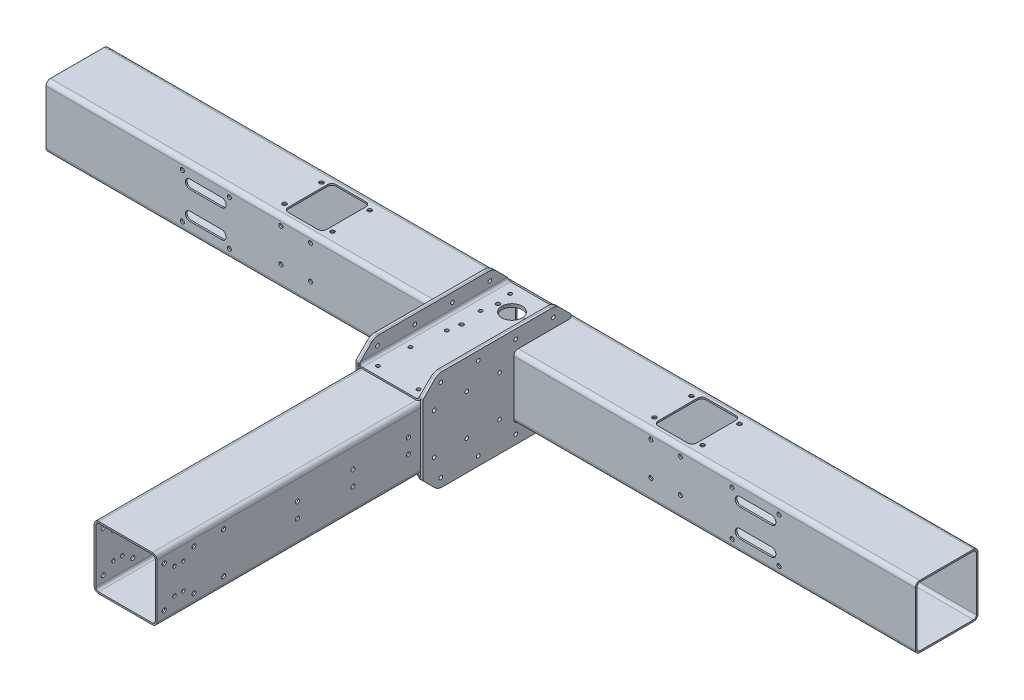
from build123d import *

# Parameters (mm, degrees)
STRUCTURAL_MEMBER1_DEPTH                 = 1175
CUT_EXTRUDE1_DEPTH                       = 595.772326783
CUT_EXTRUDE1_DEPTH_BACK                  = 595.772326783
STRUCTURAL_MEMBER2_DEPTH                 = 480
CUT_EXTRUDE2_DEPTH                       = 2.159
SKETCH18_W                               = 2.75
SKETCH18_H                               = 2.16
M5_CLEARANCE_HOLE_HANDLE_SIDE_AT_2_COUNT = 2
M5_CLEARANCE_HOLE_HANDLE_SIDE_AT_2_PITCH = 40
M5_CLEARANCE_HOLE_HANDLE_SIDE_AT_3_COUNT = 2
M5_CLEARANCE_HOLE_HANDLE_SIDE_AT_3_PITCH = 60.207972894
M5_CLEARANCE_HOLE_HANDLE_SIDE_AT_4_COUNT = 2
M5_CLEARANCE_HOLE_HANDLE_SIDE_AT_4_PITCH = 45
M5_CLEARANCE_HOLE_HANDLE_SIDE_AT_5_COUNT = 2
M5_CLEARANCE_HOLE_HANDLE_SIDE_AT_5_PITCH = 541.871756046
M5_CLEARANCE_HOLE_HANDLE_SIDE_AT_6_COUNT = 2
M5_CLEARANCE_HOLE_HANDLE_SIDE_AT_6_PITCH = 502.020915899
M5_CLEARANCE_HOLE_HANDLE_SIDE_AT_7_COUNT = 2
M5_CLEARANCE_HOLE_HANDLE_SIDE_AT_7_PITCH = 500
M5_CLEARANCE_HOLE_HANDLE_SIDE_AT_8_COUNT = 2
M5_CLEARANCE_HOLE_HANDLE_SIDE_AT_8_PITCH = 540
SKETCH161_W                              = 2.75
SKETCH161_H                              = 2.16
M5_CLEARANCE_HOLE_HANDLE_TOP_AT_2_COUNT  = 2
M5_CLEARANCE_HOLE_HANDLE_TOP_AT_2_PITCH  = 65
M5_CLEARANCE_HOLE_HANDLE_TOP_AT_3_COUNT  = 2
M5_CLEARANCE_HOLE_HANDLE_TOP_AT_3_PITCH  = 82.006097334
M5_CLEARANCE_HOLE_HANDLE_TOP_AT_4_COUNT  = 2
M5_CLEARANCE_HOLE_HANDLE_TOP_AT_4_PITCH  = 50
M5_CLEARANCE_HOLE_HANDLE_TOP_AT_5_COUNT  = 2
M5_CLEARANCE_HOLE_HANDLE_TOP_AT_5_PITCH  = 567.208074696
M5_CLEARANCE_HOLE_HANDLE_TOP_AT_6_COUNT  = 2
M5_CLEARANCE_HOLE_HANDLE_TOP_AT_6_PITCH  = 502.493781056
M5_CLEARANCE_HOLE_HANDLE_TOP_AT_7_COUNT  = 2
M5_CLEARANCE_HOLE_HANDLE_TOP_AT_7_PITCH  = 500
M5_CLEARANCE_HOLE_HANDLE_TOP_AT_8_COUNT  = 2
M5_CLEARANCE_HOLE_HANDLE_TOP_AT_8_PITCH  = 565
CUT_EXTRUDE4_DEPTH                       = 2.159
SKETCH120_W                              = 2.75
SKETCH120_H                              = 2.16
M5_CLEARANCE_HOLE1_AT_2_COUNT            = 2
M5_CLEARANCE_HOLE1_AT_2_PITCH            = 63.5
M5_CLEARANCE_HOLE1_AT_3_COUNT            = 2
M5_CLEARANCE_HOLE1_AT_3_PITCH            = 87.586275323
M5_CLEARANCE_HOLE1_AT_4_COUNT            = 2
M5_CLEARANCE_HOLE1_AT_4_PITCH            = 60.325
M5_CLEARANCE_HOLE1_AT_5_COUNT            = 2
M5_CLEARANCE_HOLE1_AT_5_PITCH            = 808.752963287
M5_CLEARANCE_HOLE1_AT_6_COUNT            = 2
M5_CLEARANCE_HOLE1_AT_6_PITCH            = 745.444904487
M5_CLEARANCE_HOLE1_AT_7_COUNT            = 2
M5_CLEARANCE_HOLE1_AT_7_PITCH            = 743
M5_CLEARANCE_HOLE1_AT_8_COUNT            = 2
M5_CLEARANCE_HOLE1_AT_8_PITCH            = 806.5
CUT_EXTRUDE5_DEPTH                       = 2.159
SKETCH125_W                              = 2.75
SKETCH125_H                              = 2.16
CLEARANCE_HOLE10_AT_2_COUNT              = 2
CLEARANCE_HOLE10_AT_2_PITCH              = 58
CLEARANCE_HOLE10_AT_3_COUNT              = 2
CLEARANCE_HOLE10_AT_3_PITCH              = 107.912001186
CLEARANCE_HOLE10_AT_4_COUNT              = 2
CLEARANCE_HOLE10_AT_4_PITCH              = 91
SKETCH135_W                              = 2.25
SKETCH135_H                              = 629.8291
M4_CLEARANCE_HOLE_CATCH_MOUNT_AT_2_COUNT = 2
M4_CLEARANCE_HOLE_CATCH_MOUNT_AT_2_PITCH = 35
M4_CLEARANCE_HOLE_CATCH_MOUNT_AT_3_COUNT = 2
M4_CLEARANCE_HOLE_CATCH_MOUNT_AT_3_PITCH = 37
M4_CLEARANCE_HOLE_CATCH_MOUNT_AT_4_COUNT = 2
M4_CLEARANCE_HOLE_CATCH_MOUNT_AT_4_PITCH = 12
SKETCH137_W                              = 2.75
SKETCH137_H                              = 629.8291
M5_CLEARANCE_HOLE_SLIDES_AT_2_COUNT      = 2
M5_CLEARANCE_HOLE_SLIDES_AT_2_PITCH      = 40
M5_CLEARANCE_HOLE_SLIDES_AT_3_COUNT      = 2
M5_CLEARANCE_HOLE_SLIDES_AT_3_PITCH      = 80
M5_CLEARANCE_HOLE_SLIDES_AT_4_COUNT      = 2
M5_CLEARANCE_HOLE_SLIDES_AT_4_PITCH      = 97.082439195
M5_CLEARANCE_HOLE_SLIDES_AT_5_COUNT      = 2
M5_CLEARANCE_HOLE_SLIDES_AT_5_PITCH      = 68.007352544
M5_CLEARANCE_HOLE_SLIDES_AT_6_COUNT      = 2
M5_CLEARANCE_HOLE_SLIDES_AT_6_PITCH      = 55
BOSS_EXTRUDE6_START                      = -8
BOSS_EXTRUDE6_DEPTH                      = 200
BOSS_EXTRUDE6_2_DEPTH                    = 200
CHAMFER1_SIZE                            = 20
CHAMFER2_SIZE                            = 20
BOSS_CENTER_PLATE_DEPTH                  = 3.175
SKETCH142_W                              = 2.4257
SKETCH142_H                              = 633.0041
F_11_0_191_DIAMETER_HOLE1_AT_2_COUNT     = 2
F_11_0_191_DIAMETER_HOLE1_AT_2_PITCH     = 111.4582
SKETCH144_W                              = 2.4257
SKETCH144_H                              = 633.0041
F_11_0_191_DIAMETER_HOLE2_AT_2_COUNT     = 2
F_11_0_191_DIAMETER_HOLE2_AT_2_PITCH     = 55
CRVPATTERN3_START                        = 41
CRVPATTERN3_OUTLINE_R                    = 2.4257
CRVPATTERN3_DEPTH                        = 6
CRVPATTERN3_START_2                      = -43
CRVPATTERN3_2_OUTLINE_R                  = 2.4257
CRVPATTERN3_2_DEPTH                      = 86
CRVPATTERN3_3_OUTLINE_R                  = 2.4257
CRVPATTERN3_3_DEPTH                      = 86
CRVPATTERN4_START                        = 42.3291
CRVPATTERN4_OUTLINE_R                    = 2.4257
CRVPATTERN4_DEPTH                        = 3.175
CRVPATTERN4_START_2                      = -43
CRVPATTERN4_2_OUTLINE_R                  = 2.4257
CRVPATTERN4_2_DEPTH                      = 86
SKETCH146_W                              = 2.4257
SKETCH146_H                              = 112.2172
F_11_0_191_DIAMETER_HOLE3_AT_2_COUNT     = 2
F_11_0_191_DIAMETER_HOLE3_AT_2_PITCH     = 55
CRVPATTERN10_START                       = -45
CRVPATTERN10_OUTLINE_R                   = 2.4257
CRVPATTERN10_DEPTH                       = 4
CRVPATTERN10_START_2                     = 41
CRVPATTERN10_2_OUTLINE_R                 = 2.4257
CRVPATTERN10_2_DEPTH                     = 4
CRVPATTERN10_START_3                     = -43
CRVPATTERN10_3_OUTLINE_R                 = 2.4257
CRVPATTERN10_3_DEPTH                     = 86
CUT_EXTRUDE10_DEPTH                      = 824.473806694
CUT_EXTRUDE9_START                       = -4.318
SKETCH148_R                              = 13.75
CUT_EXTRUDE9_DEPTH                       = 4.318
CLEARANCE_START                          = 41
CLEARANCE_HOLE11_OUTLINE_R               = 2.75
CLEARANCE_HOLE11_DEPTH                   = 4
CLEARANCE_START_2                        = 39
CLEARANCE_HOLE11_2_OUTLINE_R             = 2.75
CLEARANCE_HOLE11_2_DEPTH                 = 4
CUT_EXTRUDE11_DEPTH                      = 2.159
F_0_191_START                            = 41
F_0_191_DIAMETER_HOLE5_OUTLINE_R         = 2.4257
F_0_191_DIAMETER_HOLE5_DEPTH             = 4
F_0_191_START_2                          = 39
F_0_191_DIAMETER_HOLE5_2_OUTLINE_R       = 2.4257
F_0_191_DIAMETER_HOLE5_2_DEPTH           = 4
F_0_191_DIAMETER_HOLE5_3_OUTLINE_R       = 2.4257
F_0_191_DIAMETER_HOLE5_3_DEPTH           = 4
F_11_START                               = -44.4881
F_11_0_191_DIAMETER_HOLE5_OUTLINE_R      = 2.4257
F_11_0_191_DIAMETER_HOLE5_DEPTH          = 2.159
F_11_START_2                             = -43
F_11_0_191_DIAMETER_HOLE5_2_OUTLINE_R    = 2.4257
F_11_0_191_DIAMETER_HOLE5_2_DEPTH        = 4
F_11_0_191_DIAMETER_HOLE5_3_OUTLINE_R    = 2.4257
F_11_0_191_DIAMETER_HOLE5_3_DEPTH        = 4
M5_START                                 = 41
M5_CLEARANCE_HOLE4_OUTLINE_R             = 2.75
M5_CLEARANCE_HOLE4_DEPTH                 = 4
M5_START_2                               = 39
M5_CLEARANCE_HOLE4_2_OUTLINE_R           = 2.75
M5_CLEARANCE_HOLE4_2_DEPTH               = 4
M5_START_3                               = -45
M5_CLEARANCE_HOLE6_OUTLINE_R             = 2.75
M5_CLEARANCE_HOLE6_DEPTH                 = 4
M5_START_4                               = -43
M5_CLEARANCE_HOLE6_2_OUTLINE_R           = 2.75
M5_CLEARANCE_HOLE6_2_DEPTH               = 4
SKETCH163_W                              = 2.75
SKETCH163_H                              = 629.8291
M5_CLEARANCE_HOLE9_AT_2_COUNT            = 2
M5_CLEARANCE_HOLE9_AT_2_PITCH            = 75
M5_CLEARANCE_HOLE9_AT_3_COUNT            = 2
M5_CLEARANCE_HOLE9_AT_3_PITCH            = 150
M5_CLEARANCE_HOLE9_AT_4_COUNT            = 2
M5_CLEARANCE_HOLE9_AT_4_PITCH            = 151.340708337
M5_CLEARANCE_HOLE9_AT_5_COUNT            = 2
M5_CLEARANCE_HOLE9_AT_5_PITCH            = 77.646699865
M5_CLEARANCE_HOLE9_AT_6_COUNT            = 2
M5_CLEARANCE_HOLE9_AT_6_PITCH            = 20.1
FILLET2_R                                = 15
FILLET3_R                                = 2
FILLET4_R                                = 15
FILLET5_R                                = 2
FILLET6_R                                = 15
FILLET7_R                                = 2


with BuildPart() as part:
    # Sketch167 → Structural Member1 (new body)
    with BuildSketch(Plane(origin=(-587.5, 0, 0), x_dir=(0, 0, -1), z_dir=(1, 0, 0))):
        with BuildLine():
            Line((-42.3291, 36.3855), (-42.3291, -36.3855))
            ThreePointArc((-42.3291, -36.3855), (-40.588259865, -40.588259865), (-36.3855, -42.3291))
            Line((-36.3855, -42.3291), (36.3855, -42.3291))
            ThreePointArc((36.3855, -42.3291), (40.588259865, -40.588259865), (42.3291, -36.3855))
            Line((42.3291, -36.3855), (42.3291, 36.3855))
            ThreePointArc((42.3291, 36.3855), (40.588259865, 40.588259865), (36.3855, 42.3291))
            Line((36.3855, 42.3291), (-36.3855, 42.3291))
            ThreePointArc((-36.3855, 42.3291), (-40.588259865, 40.588259865), (-42.3291, 36.3855))
        make_face()
        with BuildLine():
            Line((-40.1701, 36.3855), (-40.1701, -36.3855))
            ThreePointArc((-40.1701, -36.3855), (-39.061616324, -39.061616324), (-36.3855, -40.1701))
            Line((-36.3855, -40.1701), (36.3855, -40.1701))
            ThreePointArc((36.3855, -40.1701), (39.061616324, -39.061616324), (40.1701, -36.3855))
            Line((40.1701, -36.3855), (40.1701, 36.3855))
            ThreePointArc((40.1701, 36.3855), (39.061616324, 39.061616324), (36.3855, 40.1701))
            Line((36.3855, 40.1701), (-36.3855, 40.1701))
            ThreePointArc((-36.3855, 40.1701), (-39.061616324, 39.061616324), (-40.1701, 36.3855))
        make_face(mode=Mode.SUBTRACT)
    extrude(amount=STRUCTURAL_MEMBER1_DEPTH)

    # Sketch12 → Cut-Extrude1 (cut, two sides: drawn at the far end of the back side and taken through both)
    with BuildSketch(Plane(origin=(0, 0, 40.1701), x_dir=(-1, 0, 0), z_dir=(0, 0, -1)).offset(-CUT_EXTRUDE1_DEPTH_BACK)):
        with BuildLine():
            Line((29.15, -35.5), (-29.15, -35.5))
            ThreePointArc((-29.15, -35.5), (-33.640128061, -33.640128061), (-35.5, -29.15))
            Line((-35.5, -29.15), (-35.5, 29.15))
            ThreePointArc((-35.5, 29.15), (-33.640128061, 33.640128061), (-29.15, 35.5))
            Line((-29.15, 35.5), (29.15, 35.5))
            ThreePointArc((29.15, 35.5), (33.640128061, 33.640128061), (35.5, 29.15))
            Line((35.5, 29.15), (35.5, -29.15))
            ThreePointArc((35.5, -29.15), (33.640128061, -33.640128061), (29.15, -35.5))
        make_face()
    extrude(amount=CUT_EXTRUDE1_DEPTH + CUT_EXTRUDE1_DEPTH_BACK, mode=Mode.SUBTRACT)

    # Sketch17 → Cut-Extrude2 (cut)
    with BuildSketch(Plane(origin=(0, 42.3291, 0), x_dir=(1, 0, 0), z_dir=(0, 1, 0))):
        with BuildLine():
            Line((-270, 32.5), (-230, 32.5))
            ThreePointArc((-230, 32.5), (-225.757359313, 30.742640687), (-224, 26.5))
            Line((-224, 26.5), (-224, -26.5))
            ThreePointArc((-224, -26.5), (-225.757359313, -30.742640687), (-230, -32.5))
            Line((-230, -32.5), (-270, -32.5))
            ThreePointArc((-270, -32.5), (-274.242640687, -30.742640687), (-276, -26.5))
            Line((-276, -26.5), (-276, 26.5))
            ThreePointArc((-276, 26.5), (-274.242640687, 30.742640687), (-270, 32.5))
        make_face()
        with BuildLine():
            Line((276, 26.5), (276, -26.5))
            ThreePointArc((276, -26.5), (274.242640687, -30.742640687), (270, -32.5))
            Line((270, -32.5), (230, -32.5))
            ThreePointArc((230, -32.5), (225.757359313, -30.742640687), (224, -26.5))
            Line((224, -26.5), (224, 26.5))
            ThreePointArc((224, 26.5), (225.757359313, 30.742640687), (230, 32.5))
            Line((230, 32.5), (270, 32.5))
            ThreePointArc((270, 32.5), (274.242640687, 30.742640687), (276, 26.5))
        make_face()
    extrude(amount=-CUT_EXTRUDE2_DEPTH, mode=Mode.SUBTRACT)

    # Sketch18 → M5 Clearance Hole- HANDLE SIDE (revolve, cut)
    with BuildSketch(Plane(origin=(-270, 31.384, 42.3291), x_dir=(0, -1, 0), z_dir=(1, 0, 0))):
        with Locations((1.375, 1.08)):
            Rectangle(SKETCH18_W, SKETCH18_H)
    m5_clearance_hole_handle_side = revolve(axis=Axis((-270, 31.384, 48.6791), (0, 0, -1)), mode=Mode.SUBTRACT)

    # M5 Clearance Hole- HANDLE SIDE at 2: M5 Clearance Hole- HANDLE SIDE ×2
    with Locations(*[(i * M5_CLEARANCE_HOLE_HANDLE_SIDE_AT_2_PITCH, 0, 0) for i in range(1, M5_CLEARANCE_HOLE_HANDLE_SIDE_AT_2_COUNT)]):
        add(m5_clearance_hole_handle_side, mode=Mode.SUBTRACT)

    # M5 Clearance Hole- HANDLE SIDE at 3: M5 Clearance Hole- HANDLE SIDE ×2
    with Locations(*[Vector(0.6643638388299201, -0.7474093186836595, 0) * (i * M5_CLEARANCE_HOLE_HANDLE_SIDE_AT_3_PITCH) for i in range(1, M5_CLEARANCE_HOLE_HANDLE_SIDE_AT_3_COUNT)]):
        add(m5_clearance_hole_handle_side, mode=Mode.SUBTRACT)

    # M5 Clearance Hole- HANDLE SIDE at 4: M5 Clearance Hole- HANDLE SIDE ×2
    with Locations(*[(0, -i * M5_CLEARANCE_HOLE_HANDLE_SIDE_AT_4_PITCH, 0) for i in range(1, M5_CLEARANCE_HOLE_HANDLE_SIDE_AT_4_COUNT)]):
        add(m5_clearance_hole_handle_side, mode=Mode.SUBTRACT)

    # M5 Clearance Hole- HANDLE SIDE at 5: M5 Clearance Hole- HANDLE SIDE ×2
    with Locations(*[Vector(0.9965457582448797, -0.08304547985373982, 0) * (i * M5_CLEARANCE_HOLE_HANDLE_SIDE_AT_5_PITCH) for i in range(1, M5_CLEARANCE_HOLE_HANDLE_SIDE_AT_5_COUNT)]):
        add(m5_clearance_hole_handle_side, mode=Mode.SUBTRACT)

    # M5 Clearance Hole- HANDLE SIDE at 6: M5 Clearance Hole- HANDLE SIDE ×2
    with Locations(*[Vector(0.9959744388432288, -0.08963769949589045, 0) * (i * M5_CLEARANCE_HOLE_HANDLE_SIDE_AT_6_PITCH) for i in range(1, M5_CLEARANCE_HOLE_HANDLE_SIDE_AT_6_COUNT)]):
        add(m5_clearance_hole_handle_side, mode=Mode.SUBTRACT)

    # M5 Clearance Hole- HANDLE SIDE at 7: M5 Clearance Hole- HANDLE SIDE ×2
    with Locations(*[(i * M5_CLEARANCE_HOLE_HANDLE_SIDE_AT_7_PITCH, 0, 0) for i in range(1, M5_CLEARANCE_HOLE_HANDLE_SIDE_AT_7_COUNT)]):
        add(m5_clearance_hole_handle_side, mode=Mode.SUBTRACT)

    # M5 Clearance Hole- HANDLE SIDE at 8: M5 Clearance Hole- HANDLE SIDE ×2
    with Locations(*[(i * M5_CLEARANCE_HOLE_HANDLE_SIDE_AT_8_PITCH, 0, 0) for i in range(1, M5_CLEARANCE_HOLE_HANDLE_SIDE_AT_8_COUNT)]):
        add(m5_clearance_hole_handle_side, mode=Mode.SUBTRACT)

    # Sketch161 → M5 Clearance Hole- HANDLE TOP (revolve, cut)
    with BuildSketch(Plane(origin=(-282.5, 42.3291, -25), x_dir=(0, 0, 1), z_dir=(1, 0, 0))):
        with Locations((1.375, 1.08)):
            Rectangle(SKETCH161_W, SKETCH161_H)
    m5_clearance_hole_handle_top = revolve(axis=Axis((-282.5, 48.6791, -25), (0, -1, 0)), mode=Mode.SUBTRACT)

    # M5 Clearance Hole- HANDLE TOP at 2: M5 Clearance Hole- HANDLE TOP ×2
    with Locations(*[(i * M5_CLEARANCE_HOLE_HANDLE_TOP_AT_2_PITCH, 0, 0) for i in range(1, M5_CLEARANCE_HOLE_HANDLE_TOP_AT_2_COUNT)]):
        add(m5_clearance_hole_handle_top, mode=Mode.SUBTRACT)

    # M5 Clearance Hole- HANDLE TOP at 3: M5 Clearance Hole- HANDLE TOP ×2
    with Locations(*[Vector(0.7926239891046006, 0, 0.6097107608496919) * (i * M5_CLEARANCE_HOLE_HANDLE_TOP_AT_3_PITCH) for i in range(1, M5_CLEARANCE_HOLE_HANDLE_TOP_AT_3_COUNT)]):
        add(m5_clearance_hole_handle_top, mode=Mode.SUBTRACT)

    # M5 Clearance Hole- HANDLE TOP at 4: M5 Clearance Hole- HANDLE TOP ×2
    with Locations(*[(0, 0, i * M5_CLEARANCE_HOLE_HANDLE_TOP_AT_4_PITCH) for i in range(1, M5_CLEARANCE_HOLE_HANDLE_TOP_AT_4_COUNT)]):
        add(m5_clearance_hole_handle_top, mode=Mode.SUBTRACT)

    # M5 Clearance Hole- HANDLE TOP at 5: M5 Clearance Hole- HANDLE TOP ×2
    with Locations(*[Vector(0.9961071169572434, 0, 0.08815107229710119) * (i * M5_CLEARANCE_HOLE_HANDLE_TOP_AT_5_PITCH) for i in range(1, M5_CLEARANCE_HOLE_HANDLE_TOP_AT_5_COUNT)]):
        add(m5_clearance_hole_handle_top, mode=Mode.SUBTRACT)

    # M5 Clearance Hole- HANDLE TOP at 6: M5 Clearance Hole- HANDLE TOP ×2
    with Locations(*[Vector(0.9950371902099892, 0, 0.09950371902099893) * (i * M5_CLEARANCE_HOLE_HANDLE_TOP_AT_6_PITCH) for i in range(1, M5_CLEARANCE_HOLE_HANDLE_TOP_AT_6_COUNT)]):
        add(m5_clearance_hole_handle_top, mode=Mode.SUBTRACT)

    # M5 Clearance Hole- HANDLE TOP at 7: M5 Clearance Hole- HANDLE TOP ×2
    with Locations(*[(i * M5_CLEARANCE_HOLE_HANDLE_TOP_AT_7_PITCH, 0, 0) for i in range(1, M5_CLEARANCE_HOLE_HANDLE_TOP_AT_7_COUNT)]):
        add(m5_clearance_hole_handle_top, mode=Mode.SUBTRACT)

    # M5 Clearance Hole- HANDLE TOP at 8: M5 Clearance Hole- HANDLE TOP ×2
    with Locations(*[(i * M5_CLEARANCE_HOLE_HANDLE_TOP_AT_8_PITCH, 0, 0) for i in range(1, M5_CLEARANCE_HOLE_HANDLE_TOP_AT_8_COUNT)]):
        add(m5_clearance_hole_handle_top, mode=Mode.SUBTRACT)

    # Sketch120 → M5 Clearance Hole1 (revolve, cut)
    with BuildSketch(Plane(origin=(-403.25, 30.1625, 42.3291), x_dir=(0, -1, 0), z_dir=(1, 0, 0))):
        with Locations((1.375, 1.08)):
            Rectangle(SKETCH120_W, SKETCH120_H)
    m5_clearance_hole1 = revolve(axis=Axis((-403.25, 30.1625, 48.6791), (0, 0, -1)), mode=Mode.SUBTRACT)

    # M5 Clearance Hole1 at 2: M5 Clearance Hole1 ×2
    with Locations(*[(i * M5_CLEARANCE_HOLE1_AT_2_PITCH, 0, 0) for i in range(1, M5_CLEARANCE_HOLE1_AT_2_COUNT)]):
        add(m5_clearance_hole1, mode=Mode.SUBTRACT)

    # M5 Clearance Hole1 at 3: M5 Clearance Hole1 ×2
    with Locations(*[Vector(0.7249994335944139, -0.6887494619146931, 0) * (i * M5_CLEARANCE_HOLE1_AT_3_PITCH) for i in range(1, M5_CLEARANCE_HOLE1_AT_3_COUNT)]):
        add(m5_clearance_hole1, mode=Mode.SUBTRACT)

    # M5 Clearance Hole1 at 4: M5 Clearance Hole1 ×2
    with Locations(*[(0, -i * M5_CLEARANCE_HOLE1_AT_4_PITCH, 0) for i in range(1, M5_CLEARANCE_HOLE1_AT_4_COUNT)]):
        add(m5_clearance_hole1, mode=Mode.SUBTRACT)

    # M5 Clearance Hole1 at 5: M5 Clearance Hole1 ×2
    with Locations(*[Vector(0.9972142750766156, -0.07459014400991548, 0) * (i * M5_CLEARANCE_HOLE1_AT_5_PITCH) for i in range(1, M5_CLEARANCE_HOLE1_AT_5_COUNT)]):
        add(m5_clearance_hole1, mode=Mode.SUBTRACT)

    # M5 Clearance Hole1 at 6: M5 Clearance Hole1 ×2
    with Locations(*[Vector(0.9967202076614105, -0.08092482708906404, 0) * (i * M5_CLEARANCE_HOLE1_AT_6_PITCH) for i in range(1, M5_CLEARANCE_HOLE1_AT_6_COUNT)]):
        add(m5_clearance_hole1, mode=Mode.SUBTRACT)

    # M5 Clearance Hole1 at 7: M5 Clearance Hole1 ×2
    with Locations(*[(i * M5_CLEARANCE_HOLE1_AT_7_PITCH, 0, 0) for i in range(1, M5_CLEARANCE_HOLE1_AT_7_COUNT)]):
        add(m5_clearance_hole1, mode=Mode.SUBTRACT)

    # M5 Clearance Hole1 at 8: M5 Clearance Hole1 ×2
    with Locations(*[(i * M5_CLEARANCE_HOLE1_AT_8_PITCH, 0, 0) for i in range(1, M5_CLEARANCE_HOLE1_AT_8_COUNT)]):
        add(m5_clearance_hole1, mode=Mode.SUBTRACT)

    # Sketch122 → Cut-Extrude5 (cut)
    with BuildSketch(Plane.XY.offset(42.3291)):
        with BuildLine():
            Line((-393, 24.75), (-350, 24.75))
            ThreePointArc((-350, 24.75), (-344, 18.75), (-350, 12.75))
            Line((-350, 12.75), (-393, 12.75))
            ThreePointArc((-393, 12.75), (-399, 18.75), (-393, 24.75))
        make_face()
        with BuildLine():
            Line((-393, -24.75), (-350, -24.75))
            ThreePointArc((-350, -24.75), (-344, -18.75), (-350, -12.75))
            Line((-350, -12.75), (-393, -12.75))
            ThreePointArc((-393, -12.75), (-399, -18.75), (-393, -24.75))
        make_face()
        with BuildLine():
            Line((393, 24.75), (350, 24.75))
            ThreePointArc((350, 24.75), (344, 18.75), (350, 12.75))
            Line((350, 12.75), (393, 12.75))
            ThreePointArc((393, 12.75), (399, 18.75), (393, 24.75))
        make_face()
        with BuildLine():
            Line((393, -24.75), (350, -24.75))
            ThreePointArc((350, -24.75), (344, -18.75), (350, -12.75))
            Line((350, -12.75), (393, -12.75))
            ThreePointArc((393, -12.75), (399, -18.75), (393, -24.75))
        make_face()
    extrude(amount=-CUT_EXTRUDE5_DEPTH, mode=Mode.SUBTRACT)

    # Sketch125 → Clearance Hole10 (revolve, cut)
    with BuildSketch(Plane(origin=(45.5, 29, -42.3291), x_dir=(0, 1, 0), z_dir=(1, 0, 0))):
        with Locations((1.375, 1.08)):
            Rectangle(SKETCH125_W, SKETCH125_H)
    clearance_hole10 = revolve(axis=Axis((45.5, 29, -48.6791), (0, 0, 1)), mode=Mode.SUBTRACT)

    # Clearance Hole10 at 2: Clearance Hole10 ×2
    with Locations(*[(0, -i * CLEARANCE_HOLE10_AT_2_PITCH, 0) for i in range(1, CLEARANCE_HOLE10_AT_2_COUNT)]):
        add(clearance_hole10, mode=Mode.SUBTRACT)

    # Clearance Hole10 at 3: Clearance Hole10 ×2
    with Locations(*[Vector(-0.8432797001236413, -0.5374749737051779, 0) * (i * CLEARANCE_HOLE10_AT_3_PITCH) for i in range(1, CLEARANCE_HOLE10_AT_3_COUNT)]):
        add(clearance_hole10, mode=Mode.SUBTRACT)

    # Clearance Hole10 at 4: Clearance Hole10 ×2
    with Locations(*[(-i * CLEARANCE_HOLE10_AT_4_PITCH, 0, 0) for i in range(1, CLEARANCE_HOLE10_AT_4_COUNT)]):
        add(clearance_hole10, mode=Mode.SUBTRACT)


with BuildPart() as body_2:
    # Sketch168 → Structural Member2 (new body)
    with BuildSketch(Plane.XY.offset(42.3291)):
        with BuildLine():
            Line((-42.3291, 36.3855), (-42.3291, -36.3855))
            ThreePointArc((-42.3291, -36.3855), (-40.588259865, -40.588259865), (-36.3855, -42.3291))
            Line((-36.3855, -42.3291), (36.3855, -42.3291))
            ThreePointArc((36.3855, -42.3291), (40.588259865, -40.588259865), (42.3291, -36.3855))
            Line((42.3291, -36.3855), (42.3291, 36.3855))
            ThreePointArc((42.3291, 36.3855), (40.588259865, 40.588259865), (36.3855, 42.3291))
            Line((36.3855, 42.3291), (-36.3855, 42.3291))
            ThreePointArc((-36.3855, 42.3291), (-40.588259865, 40.588259865), (-42.3291, 36.3855))
        make_face()
        with BuildLine():
            Line((-40.1701, 36.3855), (-40.1701, -36.3855))
            ThreePointArc((-40.1701, -36.3855), (-39.061616324, -39.061616324), (-36.3855, -40.1701))
            Line((-36.3855, -40.1701), (36.3855, -40.1701))
            ThreePointArc((36.3855, -40.1701), (39.061616324, -39.061616324), (40.1701, -36.3855))
            Line((40.1701, -36.3855), (40.1701, 36.3855))
            ThreePointArc((40.1701, 36.3855), (39.061616324, 39.061616324), (36.3855, 40.1701))
            Line((36.3855, 40.1701), (-36.3855, 40.1701))
            ThreePointArc((-36.3855, 40.1701), (-39.061616324, 39.061616324), (-40.1701, 36.3855))
        make_face(mode=Mode.SUBTRACT)
    extrude(amount=STRUCTURAL_MEMBER2_DEPTH)

    # Sketch119 → Cut-Extrude4 (cut)
    with BuildSketch(Plane.XZ.offset(42.3291)):
        with BuildLine():
            Line((-15, 332.3291), (15, 332.3291))
            ThreePointArc((15, 332.3291), (22.071067812, 329.400167812), (25, 322.3291))
            Line((25, 322.3291), (25, 192.3291))
            ThreePointArc((25, 192.3291), (22.071067812, 185.258032188), (15, 182.3291))
            Line((15, 182.3291), (-15, 182.3291))
            ThreePointArc((-15, 182.3291), (-22.071067812, 185.258032188), (-25, 192.3291))
            Line((-25, 192.3291), (-25, 322.3291))
            ThreePointArc((-25, 322.3291), (-22.071067812, 329.400167812), (-15, 332.3291))
        make_face()
    extrude(amount=-CUT_EXTRUDE4_DEPTH, mode=Mode.SUBTRACT)

    # Sketch135 → M4 Clearance Hole - CATCH MOUNT (revolve, cut)
    with BuildSketch(Plane(origin=(-42.3291, 17.5, 498.6291), x_dir=(0, 0, 1), z_dir=(0, 1, 0))):
        with Locations((1.125, 314.91455)):
            Rectangle(SKETCH135_W, SKETCH135_H)
    m4_clearance_hole_catch_mount = revolve(axis=Axis((-48.6791, 17.5, 498.6291), (1, 0, 0)), mode=Mode.SUBTRACT)

    # M4 Clearance Hole - CATCH MOUNT at 2: M4 Clearance Hole - CATCH MOUNT ×2
    with Locations(*[(0, -i * M4_CLEARANCE_HOLE_CATCH_MOUNT_AT_2_PITCH, 0) for i in range(1, M4_CLEARANCE_HOLE_CATCH_MOUNT_AT_2_COUNT)]):
        add(m4_clearance_hole_catch_mount, mode=Mode.SUBTRACT)

    # M4 Clearance Hole - CATCH MOUNT at 3: M4 Clearance Hole - CATCH MOUNT ×2
    with Locations(*[Vector(0, -0.9459459459459459, -0.3243243243243243) * (i * M4_CLEARANCE_HOLE_CATCH_MOUNT_AT_3_PITCH) for i in range(1, M4_CLEARANCE_HOLE_CATCH_MOUNT_AT_3_COUNT)]):
        add(m4_clearance_hole_catch_mount, mode=Mode.SUBTRACT)

    # M4 Clearance Hole - CATCH MOUNT at 4: M4 Clearance Hole - CATCH MOUNT ×2
    with Locations(*[(0, 0, -i * M4_CLEARANCE_HOLE_CATCH_MOUNT_AT_4_PITCH) for i in range(1, M4_CLEARANCE_HOLE_CATCH_MOUNT_AT_4_COUNT)]):
        add(m4_clearance_hole_catch_mount, mode=Mode.SUBTRACT)

    # Sketch137 → M5 Clearance Hole - SLIDES (revolve, cut)
    with BuildSketch(Plane(origin=(-42.3291, 27.5, 512.3291), x_dir=(0, 0, 1), z_dir=(0, 1, 0))):
        with Locations((1.375, 314.91455)):
            Rectangle(SKETCH137_W, SKETCH137_H)
    m5_clearance_hole_slides = revolve(axis=Axis((-48.6791, 27.5, 512.3291), (1, 0, 0)), mode=Mode.SUBTRACT)

    # M5 Clearance Hole - SLIDES at 2: M5 Clearance Hole - SLIDES ×2
    with Locations(*[(0, 0, -i * M5_CLEARANCE_HOLE_SLIDES_AT_2_PITCH) for i in range(1, M5_CLEARANCE_HOLE_SLIDES_AT_2_COUNT)]):
        add(m5_clearance_hole_slides, mode=Mode.SUBTRACT)

    # M5 Clearance Hole - SLIDES at 3: M5 Clearance Hole - SLIDES ×2
    with Locations(*[(0, 0, -i * M5_CLEARANCE_HOLE_SLIDES_AT_3_PITCH) for i in range(1, M5_CLEARANCE_HOLE_SLIDES_AT_3_COUNT)]):
        add(m5_clearance_hole_slides, mode=Mode.SUBTRACT)

    # M5 Clearance Hole - SLIDES at 4: M5 Clearance Hole - SLIDES ×2
    with Locations(*[Vector(0, -0.5665288228870654, -0.8240419241993675) * (i * M5_CLEARANCE_HOLE_SLIDES_AT_4_PITCH) for i in range(1, M5_CLEARANCE_HOLE_SLIDES_AT_4_COUNT)]):
        add(m5_clearance_hole_slides, mode=Mode.SUBTRACT)

    # M5 Clearance Hole - SLIDES at 5: M5 Clearance Hole - SLIDES ×2
    with Locations(*[Vector(0, -0.8087360843031882, -0.5881716976750467) * (i * M5_CLEARANCE_HOLE_SLIDES_AT_5_PITCH) for i in range(1, M5_CLEARANCE_HOLE_SLIDES_AT_5_COUNT)]):
        add(m5_clearance_hole_slides, mode=Mode.SUBTRACT)

    # M5 Clearance Hole - SLIDES at 6: M5 Clearance Hole - SLIDES ×2
    with Locations(*[(0, -i * M5_CLEARANCE_HOLE_SLIDES_AT_6_PITCH, 0) for i in range(1, M5_CLEARANCE_HOLE_SLIDES_AT_6_COUNT)]):
        add(m5_clearance_hole_slides, mode=Mode.SUBTRACT)


with BuildPart() as body_3:
    # Sketch140 → Boss-Extrude6 (new body)
    with BuildSketch(Plane(origin=(0, 0, -42.3291), x_dir=(-1, 0, 0), z_dir=(0, 0, -1)).offset(BOSS_EXTRUDE6_START)):
        with BuildLine():
            Line((-42.3291, 67.7291), (-42.3291, 48.2727))
            ThreePointArc((-42.3291, 48.2727), (-40.588259865, 44.069940135), (-36.3855, 42.3291))
            Line((-36.3855, 42.3291), (36.3855, 42.3291))
            ThreePointArc((36.3855, 42.3291), (40.588259865, 44.069940135), (42.3291, 48.2727))
            Line((42.3291, 48.2727), (42.3291, 67.7291))
            Line((42.3291, 67.7291), (40.1701, 67.7291))
            Line((40.1701, 67.7291), (40.1701, 48.2727))
            ThreePointArc((40.1701, 48.2727), (39.061616324, 45.596583676), (36.3855, 44.4881))
            Line((36.3855, 44.4881), (-36.3855, 44.4881))
            ThreePointArc((-36.3855, 44.4881), (-39.061616324, 45.596583676), (-40.1701, 48.2727))
            Line((-40.1701, 48.2727), (-40.1701, 67.7291))
            Line((-40.1701, 67.7291), (-42.3291, 67.7291))
        make_face()
    extrude(amount=-BOSS_EXTRUDE6_DEPTH)

    # Chamfer1
    chamfer1_edges = [body_3.edges().sort_by_distance(p)[0] for p in [
        (-41.2496, 67.7291, -34.3291),
        (41.2496, 67.7291, -34.3291),
        (-41.2496, 67.7291, 165.6709),
        (41.2496, 67.7291, 165.6709),
    ]]
    chamfer(chamfer1_edges, length=CHAMFER1_SIZE)


with BuildPart() as body_4:
    # Sketch140 → Boss-Extrude6 2 (new body)
    with BuildSketch(Plane(origin=(0, 0, -42.3291), x_dir=(-1, 0, 0), z_dir=(0, 0, -1)).offset(BOSS_EXTRUDE6_START)):
        with BuildLine():
            Line((-40.1701, -67.7291), (-40.1701, -48.2727))
            ThreePointArc((-40.1701, -48.2727), (-39.061616324, -45.596583676), (-36.3855, -44.4881))
            Line((-36.3855, -44.4881), (36.3855, -44.4881))
            ThreePointArc((36.3855, -44.4881), (39.061616324, -45.596583676), (40.1701, -48.2727))
            Line((40.1701, -48.2727), (40.1701, -67.7291))
            Line((40.1701, -67.7291), (42.3291, -67.7291))
            Line((42.3291, -67.7291), (42.3291, -48.2727))
            ThreePointArc((42.3291, -48.2727), (40.588259865, -44.069940135), (36.3855, -42.3291))
            Line((36.3855, -42.3291), (-36.3855, -42.3291))
            ThreePointArc((-36.3855, -42.3291), (-40.588259865, -44.069940135), (-42.3291, -48.2727))
            Line((-42.3291, -48.2727), (-42.3291, -67.7291))
            Line((-42.3291, -67.7291), (-40.1701, -67.7291))
        make_face()
    extrude(amount=-BOSS_EXTRUDE6_2_DEPTH)

    # Chamfer2
    chamfer2_edges = [body_4.edges().sort_by_distance(p)[0] for p in [
        (-41.2496, -67.7291, -34.3291),
        (41.2496, -67.7291, -34.3291),
        (41.2496, -67.7291, 165.6709),
        (-41.2496, -67.7291, 165.6709),
    ]]
    chamfer(chamfer2_edges, length=CHAMFER2_SIZE)


with BuildPart() as body_5:
    # Sketch141 → Boss-Center Plate (new body)
    with BuildSketch(Plane(origin=(42.3291, 0, 0), x_dir=(0, 0, -1), z_dir=(1, 0, 0))):
        with BuildLine():
            Line((-145.6709, 67.7291), (-165.6709, 47.7291))
            Line((-165.6709, 47.7291), (-165.6709, -47.7291))
            Line((-165.6709, -47.7291), (-145.6709, -67.7291))
            Line((-145.6709, -67.7291), (14.3291, -67.7291))
            Line((14.3291, -67.7291), (34.3291, -47.7291))
            Line((34.3291, -47.7291), (34.3291, -42.3291))
            Line((34.3291, -42.3291), (-37.3291, -42.3291))
            ThreePointArc((-37.3291, -42.3291), (-40.864633906, -40.864633906), (-42.3291, -37.3291))
            Line((-42.3291, -37.3291), (-42.3291, 37.3291))
            ThreePointArc((-42.3291, 37.3291), (-40.864633906, 40.864633906), (-37.3291, 42.3291))
            Line((-37.3291, 42.3291), (34.3291, 42.3291))
            Line((34.3291, 42.3291), (34.3291, 47.7291))
            Line((34.3291, 47.7291), (14.3291, 67.7291))
            Line((14.3291, 67.7291), (-145.6709, 67.7291))
        make_face()
    extrude(amount=BOSS_CENTER_PLATE_DEPTH)


with BuildPart() as f_11_0_191_diameter_hole1_tool:
    # Sketch142 → #11 (0.191) Diameter Hole1 (revolve)
    with BuildSketch(Plane(origin=(45.5041, 55.7291, 141.6709), x_dir=(0, 0, -1), z_dir=(0, 1, 0))):
        with Locations((1.21285, 316.50205)):
            Rectangle(SKETCH142_W, SKETCH142_H)
    f_11_0_191_diameter_hole1 = revolve(axis=Axis((51.8541, 55.7291, 141.6709), (-1, 0, 0)))


with BuildPart() as body_3_1:
    add(body_3.part)

    # #11 (0.191) Diameter Hole1: cut by f_11_0_191_diameter_hole1_tool
    add(f_11_0_191_diameter_hole1_tool.part, mode=Mode.SUBTRACT)

    # CrvPattern3 3 outline → CrvPattern3 3 (cut)
    with BuildSketch(Plane.YZ.offset(CRVPATTERN3_START_2)):
        with Locations((55.7291, 91.004233333)):
            Circle(CRVPATTERN3_3_OUTLINE_R)
        with Locations((55.7291, 40.337566667)):
            Circle(CRVPATTERN3_3_OUTLINE_R)
        with Locations((55.7291, -10.3291)):
            Circle(CRVPATTERN3_3_OUTLINE_R)
    extrude(amount=CRVPATTERN3_3_DEPTH, mode=Mode.SUBTRACT)


with BuildPart() as body_5_1:
    add(body_5.part)

    # #11 (0.191) Diameter Hole1: cut by f_11_0_191_diameter_hole1_tool
    add(f_11_0_191_diameter_hole1_tool.part, mode=Mode.SUBTRACT)


with BuildPart() as f_11_0_191_diameter_hole1_at_2_tool:
    # #11 (0.191) Diameter Hole1 at 2: #11 (0.191) Diameter Hole1 ×2
    with Locations(*[(0, -i * F_11_0_191_DIAMETER_HOLE1_AT_2_PITCH, 0) for i in range(1, F_11_0_191_DIAMETER_HOLE1_AT_2_COUNT)]):
        add(f_11_0_191_diameter_hole1)


with BuildPart() as body_4_1:
    add(body_4.part)

    # #11 (0.191) Diameter Hole1 at 2: cut by f_11_0_191_diameter_hole1_at_2_tool
    add(f_11_0_191_diameter_hole1_at_2_tool.part, mode=Mode.SUBTRACT)

    # CrvPattern3 2 outline → CrvPattern3 2 (cut)
    with BuildSketch(Plane.YZ.offset(CRVPATTERN3_START_2)):
        with Locations((-55.7291, 91.004233333)):
            Circle(CRVPATTERN3_2_OUTLINE_R)
        with Locations((-55.7291, 40.337566667)):
            Circle(CRVPATTERN3_2_OUTLINE_R)
        with Locations((-55.7291, -10.3291)):
            Circle(CRVPATTERN3_2_OUTLINE_R)
    extrude(amount=CRVPATTERN3_2_DEPTH, mode=Mode.SUBTRACT)


with BuildPart() as body_5_2:
    add(body_5_1.part)

    # #11 (0.191) Diameter Hole1 at 2: cut by f_11_0_191_diameter_hole1_at_2_tool
    add(f_11_0_191_diameter_hole1_at_2_tool.part, mode=Mode.SUBTRACT)


with BuildPart() as f_11_0_191_diameter_hole2_tool:
    # Sketch144 → #11 (0.191) Diameter Hole2 (revolve)
    with BuildSketch(Plane(origin=(45.5041, 27.5, 150.6709), x_dir=(0, 0, -1), z_dir=(0, 1, 0))):
        with Locations((1.21285, 316.50205)):
            Rectangle(SKETCH144_W, SKETCH144_H)
    f_11_0_191_diameter_hole2 = revolve(axis=Axis((51.8541, 27.5, 150.6709), (-1, 0, 0)))


with BuildPart() as body_2_1:
    add(body_2.part)

    # #11 (0.191) Diameter Hole2: cut by f_11_0_191_diameter_hole2_tool
    add(f_11_0_191_diameter_hole2_tool.part, mode=Mode.SUBTRACT)


with BuildPart() as body_5_3:
    add(body_5_2.part)

    # #11 (0.191) Diameter Hole2: cut by f_11_0_191_diameter_hole2_tool
    add(f_11_0_191_diameter_hole2_tool.part, mode=Mode.SUBTRACT)


with BuildPart() as f_11_0_191_diameter_hole2_at_2_tool:
    # #11 (0.191) Diameter Hole2 at 2: #11 (0.191) Diameter Hole2 ×2
    with Locations(*[(0, -i * F_11_0_191_DIAMETER_HOLE2_AT_2_PITCH, 0) for i in range(1, F_11_0_191_DIAMETER_HOLE2_AT_2_COUNT)]):
        add(f_11_0_191_diameter_hole2)


with BuildPart() as body_2_2:
    add(body_2_1.part)

    # #11 (0.191) Diameter Hole2 at 2: cut by f_11_0_191_diameter_hole2_at_2_tool
    add(f_11_0_191_diameter_hole2_at_2_tool.part, mode=Mode.SUBTRACT)

    # CrvPattern4 2 outline → CrvPattern4 2 (cut)
    with BuildSketch(Plane.YZ.offset(CRVPATTERN4_START_2)):
        with Locations((27.5, 106.5)):
            Circle(CRVPATTERN4_2_OUTLINE_R)
        with Locations((27.5, 62.3291)):
            Circle(CRVPATTERN4_2_OUTLINE_R)
        with Locations((-27.5, 106.5)):
            Circle(CRVPATTERN4_2_OUTLINE_R)
        with Locations((-27.5, 62.3291)):
            Circle(CRVPATTERN4_2_OUTLINE_R)
    extrude(amount=CRVPATTERN4_2_DEPTH, mode=Mode.SUBTRACT)


with BuildPart() as body_5_4:
    add(body_5_3.part)

    # #11 (0.191) Diameter Hole2 at 2: cut by f_11_0_191_diameter_hole2_at_2_tool
    add(f_11_0_191_diameter_hole2_at_2_tool.part, mode=Mode.SUBTRACT)

    # CrvPattern3: read off the stored shape, not the designer's step
    # CrvPattern3 outline → CrvPattern3 (cut)
    with BuildSketch(Plane.YZ.offset(CRVPATTERN3_START)):
        with Locations((55.7291, 91.004233333)):
            Circle(CRVPATTERN3_OUTLINE_R)
        with Locations((55.7291, 40.337566667)):
            Circle(CRVPATTERN3_OUTLINE_R)
        with Locations((55.7291, -10.3291)):
            Circle(CRVPATTERN3_OUTLINE_R)
        with Locations((-55.7291, 91.004233333)):
            Circle(CRVPATTERN3_OUTLINE_R)
        with Locations((-55.7291, 40.337566667)):
            Circle(CRVPATTERN3_OUTLINE_R)
        with Locations((-55.7291, -10.3291)):
            Circle(CRVPATTERN3_OUTLINE_R)
    extrude(amount=CRVPATTERN3_DEPTH, mode=Mode.SUBTRACT)

    # CrvPattern4: read off the stored shape, not the designer's step
    # CrvPattern4 outline → CrvPattern4 (cut)
    with BuildSketch(Plane.YZ.offset(CRVPATTERN4_START)):
        with Locations((27.5, 106.5)):
            Circle(CRVPATTERN4_OUTLINE_R)
        with Locations((27.5, 62.3291)):
            Circle(CRVPATTERN4_OUTLINE_R)
        with Locations((-27.5, 106.5)):
            Circle(CRVPATTERN4_OUTLINE_R)
        with Locations((-27.5, 62.3291)):
            Circle(CRVPATTERN4_OUTLINE_R)
    extrude(amount=CRVPATTERN4_DEPTH, mode=Mode.SUBTRACT)

    # Sketch151 → Cut-Extrude10 (cut, through all)
    with BuildSketch(Plane(origin=(45.5041, 0, 0), x_dir=(0, 0, -1), z_dir=(1, 0, 0))):
        with BuildLine():
            Line((33.8291, 42.8291), (-37.3291, 42.8291))
            ThreePointArc((-37.3291, 42.8291), (-41.218187297, 41.218187297), (-42.8291, 37.3291))
            Line((-42.8291, 37.3291), (-42.8291, -37.3291))
            ThreePointArc((-42.8291, -37.3291), (-41.218187297, -41.218187297), (-37.3291, -42.8291))
            Line((-37.3291, -42.8291), (33.8291, -42.8291))
            Line((33.8291, -42.8291), (34.3291, -42.8291))
            Line((34.3291, -42.8291), (34.3291, -42.3291))
            Line((34.3291, -42.3291), (-37.3291, -42.3291))
            ThreePointArc((-37.3291, -42.3291), (-40.864633906, -40.864633906), (-42.3291, -37.3291))
            Line((-42.3291, -37.3291), (-42.3291, 37.3291))
            ThreePointArc((-42.3291, 37.3291), (-40.864633906, 40.864633906), (-37.3291, 42.3291))
            Line((-37.3291, 42.3291), (34.3291, 42.3291))
            Line((34.3291, 42.3291), (34.3291, 42.8291))
            Line((34.3291, 42.8291), (33.8291, 42.8291))
        make_face()
    extrude(amount=-CUT_EXTRUDE10_DEPTH, mode=Mode.SUBTRACT)

    # Fillet2
    fillet2_edges = [body_5_4.edges().sort_by_distance(p)[0] for p in [
        (43.9166, 67.7291, -14.3291),
        (43.9166, -67.7291, -14.3291),
        (43.9166, -67.7291, 145.6709),
        (43.9166, 67.7291, 145.6709),
    ]]
    fillet(fillet2_edges, radius=FILLET2_R)

    # Fillet3
    fillet3_edges = [body_5_4.edges().sort_by_distance(p)[0] for p in [
        (43.9166, 42.8291, -34.3291),
        (43.9166, -42.8291, -34.3291),
        (43.9166, 47.7291, -34.3291),
        (43.9166, -47.7291, -34.3291),
        (43.9166, -47.7291, 165.6709),
        (43.9166, 47.7291, 165.6709),
    ]]
    fillet(fillet3_edges, radius=FILLET3_R)


with BuildPart() as f_11_0_191_diameter_hole3_tool:
    # Sketch146 → #11 (0.191) Diameter Hole3 (revolve)
    with BuildSketch(Plane(origin=(-27.5, 44.4881, 153.6709), x_dir=(0, 0, 1), z_dir=(1, 0, 0))):
        with Locations((1.21285, 56.1086)):
            Rectangle(SKETCH146_W, SKETCH146_H)
    f_11_0_191_diameter_hole3 = revolve(axis=Axis((-27.5, 50.8381, 153.6709), (0, -1, 0)))


with BuildPart() as body_2_3:
    add(body_2_2.part)

    # #11 (0.191) Diameter Hole3: cut by f_11_0_191_diameter_hole3_tool
    add(f_11_0_191_diameter_hole3_tool.part, mode=Mode.SUBTRACT)


with BuildPart() as body_3_2:
    add(body_3_1.part)

    # #11 (0.191) Diameter Hole3: cut by f_11_0_191_diameter_hole3_tool
    add(f_11_0_191_diameter_hole3_tool.part, mode=Mode.SUBTRACT)


with BuildPart() as body_4_2:
    add(body_4_1.part)

    # #11 (0.191) Diameter Hole3: cut by f_11_0_191_diameter_hole3_tool
    add(f_11_0_191_diameter_hole3_tool.part, mode=Mode.SUBTRACT)


with BuildPart() as f_11_0_191_diameter_hole3_at_2_tool:
    # #11 (0.191) Diameter Hole3 at 2: #11 (0.191) Diameter Hole3 ×2
    with Locations(*[(i * F_11_0_191_DIAMETER_HOLE3_AT_2_PITCH, 0, 0) for i in range(1, F_11_0_191_DIAMETER_HOLE3_AT_2_COUNT)]):
        add(f_11_0_191_diameter_hole3)


with BuildPart() as body_2_4:
    add(body_2_3.part)

    # #11 (0.191) Diameter Hole3 at 2: cut by f_11_0_191_diameter_hole3_at_2_tool
    add(f_11_0_191_diameter_hole3_at_2_tool.part, mode=Mode.SUBTRACT)

    # CrvPattern10 3 outline → CrvPattern10 3 (cut)
    with BuildSketch(Plane(origin=(0, 0, 0), x_dir=(1, 0, 0), z_dir=(0, 1, 0)).offset(CRVPATTERN10_START_3)):
        with Locations((-27.5, -109.6709)):
            Circle(CRVPATTERN10_3_OUTLINE_R)
        with Locations((27.5, -109.6709)):
            Circle(CRVPATTERN10_3_OUTLINE_R)
    extrude(amount=CRVPATTERN10_3_DEPTH, mode=Mode.SUBTRACT)

    # 0.191_ Diameter Hole5 2 outline → 0.191_ Diameter Hole5 2 (cut)
    with BuildSketch(Plane(origin=(0, 0, 0), x_dir=(1, 0, 0), z_dir=(0, 1, 0)).offset(F_0_191_START_2)):
        with Locations((22.5, -65.6709)):
            Circle(F_0_191_DIAMETER_HOLE5_2_OUTLINE_R)
        with Locations((-22.5, -65.6709)):
            Circle(F_0_191_DIAMETER_HOLE5_2_OUTLINE_R)
    extrude(amount=F_0_191_DIAMETER_HOLE5_2_DEPTH, mode=Mode.SUBTRACT)

    # 11 _0.191_ Diameter Hole5 2 outline → 11 _0.191_ Diameter Hole5 2 (cut)
    with BuildSketch(Plane(origin=(0, 0, 0), x_dir=(1, 0, 0), z_dir=(0, 1, 0)).offset(F_11_START_2)):
        with Locations((-27.5, -65.6709)):
            Circle(F_11_0_191_DIAMETER_HOLE5_2_OUTLINE_R)
        with Locations((27.5, -65.6709)):
            Circle(F_11_0_191_DIAMETER_HOLE5_2_OUTLINE_R)
    extrude(amount=F_11_0_191_DIAMETER_HOLE5_2_DEPTH, mode=Mode.SUBTRACT)

    # M5 Clearance Hole4 2 outline → M5 Clearance Hole4 2 (cut)
    with BuildSketch(Plane(origin=(0, 0, 0), x_dir=(1, 0, 0), z_dir=(0, 1, 0)).offset(M5_START_2)):
        with Locations((19.5, -48.6709)):
            Circle(M5_CLEARANCE_HOLE4_2_OUTLINE_R)
        with Locations((-19.5, -48.6709)):
            Circle(M5_CLEARANCE_HOLE4_2_OUTLINE_R)
    extrude(amount=M5_CLEARANCE_HOLE4_2_DEPTH, mode=Mode.SUBTRACT)

    # M5 Clearance Hole6 2 outline → M5 Clearance Hole6 2 (cut)
    with BuildSketch(Plane(origin=(0, 0, 0), x_dir=(1, 0, 0), z_dir=(0, 1, 0)).offset(M5_START_4)):
        with Locations((-31, -48.6709)):
            Circle(M5_CLEARANCE_HOLE6_2_OUTLINE_R)
        with Locations((31, -48.6709)):
            Circle(M5_CLEARANCE_HOLE6_2_OUTLINE_R)
    extrude(amount=M5_CLEARANCE_HOLE6_2_DEPTH, mode=Mode.SUBTRACT)

    # Sketch163 → M5 Clearance Hole9 (revolve, cut)
    with BuildSketch(Plane(origin=(-42.3291, 10.05, 332.3291), x_dir=(0, 0, 1), z_dir=(0, 1, 0))):
        with Locations((1.375, 314.91455)):
            Rectangle(SKETCH163_W, SKETCH163_H)
    m5_clearance_hole9 = revolve(axis=Axis((-48.6791, 10.05, 332.3291), (1, 0, 0)), mode=Mode.SUBTRACT)

    # M5 Clearance Hole9 at 2: M5 Clearance Hole9 ×2
    with Locations(*[(0, 0, -i * M5_CLEARANCE_HOLE9_AT_2_PITCH) for i in range(1, M5_CLEARANCE_HOLE9_AT_2_COUNT)]):
        add(m5_clearance_hole9, mode=Mode.SUBTRACT)

    # M5 Clearance Hole9 at 3: M5 Clearance Hole9 ×2
    with Locations(*[(0, 0, -i * M5_CLEARANCE_HOLE9_AT_3_PITCH) for i in range(1, M5_CLEARANCE_HOLE9_AT_3_COUNT)]):
        add(m5_clearance_hole9, mode=Mode.SUBTRACT)

    # M5 Clearance Hole9 at 4: M5 Clearance Hole9 ×2
    with Locations(*[Vector(0, -0.13281291082117755, -0.9911411255311758) * (i * M5_CLEARANCE_HOLE9_AT_4_PITCH) for i in range(1, M5_CLEARANCE_HOLE9_AT_4_COUNT)]):
        add(m5_clearance_hole9, mode=Mode.SUBTRACT)

    # M5 Clearance Hole9 at 5: M5 Clearance Hole9 ×2
    with Locations(*[Vector(0, -0.25886483308141084, -0.9659135562739212) * (i * M5_CLEARANCE_HOLE9_AT_5_PITCH) for i in range(1, M5_CLEARANCE_HOLE9_AT_5_COUNT)]):
        add(m5_clearance_hole9, mode=Mode.SUBTRACT)

    # M5 Clearance Hole9 at 6: M5 Clearance Hole9 ×2
    with Locations(*[(0, -i * M5_CLEARANCE_HOLE9_AT_6_PITCH, 0) for i in range(1, M5_CLEARANCE_HOLE9_AT_6_COUNT)]):
        add(m5_clearance_hole9, mode=Mode.SUBTRACT)


with BuildPart() as body_3_3:
    add(body_3_2.part)

    # #11 (0.191) Diameter Hole3 at 2: cut by f_11_0_191_diameter_hole3_at_2_tool
    add(f_11_0_191_diameter_hole3_at_2_tool.part, mode=Mode.SUBTRACT)

    # CrvPattern10 2 outline → CrvPattern10 2 (cut)
    with BuildSketch(Plane(origin=(0, 0, 0), x_dir=(1, 0, 0), z_dir=(0, 1, 0)).offset(CRVPATTERN10_START_2)):
        with Locations((-27.5, -109.6709)):
            Circle(CRVPATTERN10_2_OUTLINE_R)
        with Locations((27.5, -109.6709)):
            Circle(CRVPATTERN10_2_OUTLINE_R)
    extrude(amount=CRVPATTERN10_2_DEPTH, mode=Mode.SUBTRACT)


with BuildPart() as body_4_3:
    add(body_4_2.part)

    # #11 (0.191) Diameter Hole3 at 2: cut by f_11_0_191_diameter_hole3_at_2_tool
    add(f_11_0_191_diameter_hole3_at_2_tool.part, mode=Mode.SUBTRACT)

    # CrvPattern10: read off the stored shape, not the designer's step
    # CrvPattern10 outline → CrvPattern10 (cut)
    with BuildSketch(Plane(origin=(0, 0, 0), x_dir=(1, 0, 0), z_dir=(0, 1, 0)).offset(CRVPATTERN10_START)):
        with Locations((-27.5, -109.6709)):
            Circle(CRVPATTERN10_OUTLINE_R)
        with Locations((27.5, -109.6709)):
            Circle(CRVPATTERN10_OUTLINE_R)
    extrude(amount=CRVPATTERN10_DEPTH, mode=Mode.SUBTRACT)

    # #11 (0.191) Diameter Hole5: read off the stored shape, not the designer's step
    # #11 (0.191) Diameter Hole5 outline → #11 (0.191) Diameter Hole5 (cut)
    with BuildSketch(Plane(origin=(0, 0, 0), x_dir=(1, 0, 0), z_dir=(0, 1, 0)).offset(F_11_START)):
        with Locations((-27.5, -65.6709)):
            Circle(F_11_0_191_DIAMETER_HOLE5_OUTLINE_R)
        with Locations((27.5, -65.6709)):
            Circle(F_11_0_191_DIAMETER_HOLE5_OUTLINE_R)
        with Locations((27.5, -20)):
            Circle(F_11_0_191_DIAMETER_HOLE5_OUTLINE_R)
        with Locations((-27.5, -20)):
            Circle(F_11_0_191_DIAMETER_HOLE5_OUTLINE_R)
        with Locations((-27.5, 20)):
            Circle(F_11_0_191_DIAMETER_HOLE5_OUTLINE_R)
        with Locations((27.5, 20)):
            Circle(F_11_0_191_DIAMETER_HOLE5_OUTLINE_R)
    extrude(amount=F_11_0_191_DIAMETER_HOLE5_DEPTH, mode=Mode.SUBTRACT)

    # M5 Clearance Hole6: read off the stored shape, not the designer's step
    # M5 Clearance Hole6 outline → M5 Clearance Hole6 (cut)
    with BuildSketch(Plane(origin=(0, 0, 0), x_dir=(1, 0, 0), z_dir=(0, 1, 0)).offset(M5_START_3)):
        with Locations((-31, -48.6709)):
            Circle(M5_CLEARANCE_HOLE6_OUTLINE_R)
        with Locations((31, -48.6709)):
            Circle(M5_CLEARANCE_HOLE6_OUTLINE_R)
    extrude(amount=M5_CLEARANCE_HOLE6_DEPTH, mode=Mode.SUBTRACT)

    # Fillet6
    fillet6_edges = [body_4_3.edges().sort_by_distance(p)[0] for p in [
        (-41.2496, -67.7291, 145.6709),
        (-41.2496, -67.7291, -14.3291),
        (41.2496, -67.7291, 145.6709),
        (41.2496, -67.7291, -14.3291),
    ]]
    fillet(fillet6_edges, radius=FILLET6_R)

    # Fillet7
    fillet7_edges = [body_4_3.edges().sort_by_distance(p)[0] for p in [
        (41.217522831, -47.7291, 165.6709),
        (-41.217522831, -47.7291, 165.6709),
        (-41.217522831, -47.7291, -34.3291),
        (41.217522831, -47.7291, -34.3291),
    ]]
    fillet(fillet7_edges, radius=FILLET7_R)


with BuildPart() as cut_extrude9_tool:
    # Sketch148 → Cut-Extrude9 (new body)
    with BuildSketch(Plane(origin=(0, 44.4881, 0), x_dir=(1, 0, 0), z_dir=(0, 1, 0)).offset(CUT_EXTRUDE9_START)):
        with Locations(Location((0, 0, 0), (0, 0, 270))):
            Circle(SKETCH148_R)
    extrude(amount=CUT_EXTRUDE9_DEPTH)


with BuildPart() as part_1:
    add(part.part)

    # Cut-Extrude9: cut by cut_extrude9_tool
    add(cut_extrude9_tool.part, mode=Mode.SUBTRACT)

    # Clearance Hole11 2 outline → Clearance Hole11 2 (cut)
    with BuildSketch(Plane(origin=(0, 0, 0), x_dir=(1, 0, 0), z_dir=(0, 1, 0)).offset(CLEARANCE_START_2)):
        with Locations((-19, 0)):
            Circle(CLEARANCE_HOLE11_2_OUTLINE_R)
        with Locations((19, 0)):
            Circle(CLEARANCE_HOLE11_2_OUTLINE_R)
    extrude(amount=CLEARANCE_HOLE11_2_DEPTH, mode=Mode.SUBTRACT)

    # Sketch152 → Cut-Extrude11 (cut)
    with BuildSketch(Plane.XZ.offset(42.3291)):
        with BuildLine():
            Line((506.2125, 10), (510.0375, 10))
            ThreePointArc((510.0375, 10), (511.160032015, 9.535032015), (511.625, 8.4125))
            Line((511.625, 8.4125), (511.625, -8.4125))
            ThreePointArc((511.625, -8.4125), (511.160032015, -9.535032015), (510.0375, -10))
            Line((510.0375, -10), (506.2125, -10))
            ThreePointArc((506.2125, -10), (505.089967985, -9.535032015), (504.625, -8.4125))
            Line((504.625, -8.4125), (504.625, 8.4125))
            ThreePointArc((504.625, 8.4125), (505.089967985, 9.535032015), (506.2125, 10))
        make_face()
        with BuildLine():
            Line((-506.2125, 10), (-510.0375, 10))
            ThreePointArc((-510.0375, 10), (-511.160032015, 9.535032015), (-511.625, 8.4125))
            Line((-511.625, 8.4125), (-511.625, -8.4125))
            ThreePointArc((-511.625, -8.4125), (-511.160032015, -9.535032015), (-510.0375, -10))
            Line((-510.0375, -10), (-506.2125, -10))
            ThreePointArc((-506.2125, -10), (-505.089967985, -9.535032015), (-504.625, -8.4125))
            Line((-504.625, -8.4125), (-504.625, 8.4125))
            ThreePointArc((-504.625, 8.4125), (-505.089967985, 9.535032015), (-506.2125, 10))
        make_face()
    extrude(amount=-CUT_EXTRUDE11_DEPTH, mode=Mode.SUBTRACT)

    # 0.191_ Diameter Hole5 3 outline → 0.191_ Diameter Hole5 3 (cut)
    with BuildSketch(Plane(origin=(0, 0, 0), x_dir=(1, 0, 0), z_dir=(0, 1, 0)).offset(F_0_191_START_2)):
        with Locations((22.5, 20)):
            Circle(F_0_191_DIAMETER_HOLE5_3_OUTLINE_R)
        with Locations((22.5, -20)):
            Circle(F_0_191_DIAMETER_HOLE5_3_OUTLINE_R)
        with Locations((-22.5, -20)):
            Circle(F_0_191_DIAMETER_HOLE5_3_OUTLINE_R)
        with Locations((-22.5, 20)):
            Circle(F_0_191_DIAMETER_HOLE5_3_OUTLINE_R)
    extrude(amount=F_0_191_DIAMETER_HOLE5_3_DEPTH, mode=Mode.SUBTRACT)

    # 11 _0.191_ Diameter Hole5 3 outline → 11 _0.191_ Diameter Hole5 3 (cut)
    with BuildSketch(Plane(origin=(0, 0, 0), x_dir=(1, 0, 0), z_dir=(0, 1, 0)).offset(F_11_START_2)):
        with Locations((27.5, -20)):
            Circle(F_11_0_191_DIAMETER_HOLE5_3_OUTLINE_R)
        with Locations((-27.5, -20)):
            Circle(F_11_0_191_DIAMETER_HOLE5_3_OUTLINE_R)
        with Locations((-27.5, 20)):
            Circle(F_11_0_191_DIAMETER_HOLE5_3_OUTLINE_R)
        with Locations((27.5, 20)):
            Circle(F_11_0_191_DIAMETER_HOLE5_3_OUTLINE_R)
    extrude(amount=F_11_0_191_DIAMETER_HOLE5_3_DEPTH, mode=Mode.SUBTRACT)


with BuildPart() as body_3_4:
    add(body_3_3.part)

    # Cut-Extrude9: cut by cut_extrude9_tool
    add(cut_extrude9_tool.part, mode=Mode.SUBTRACT)

    # Clearance Hole11: read off the stored shape, not the designer's step
    # Clearance Hole11 outline → Clearance Hole11 (cut)
    with BuildSketch(Plane(origin=(0, 0, 0), x_dir=(1, 0, 0), z_dir=(0, 1, 0)).offset(CLEARANCE_START)):
        with Locations((-19, 0)):
            Circle(CLEARANCE_HOLE11_OUTLINE_R)
        with Locations((19, 0)):
            Circle(CLEARANCE_HOLE11_OUTLINE_R)
    extrude(amount=CLEARANCE_HOLE11_DEPTH, mode=Mode.SUBTRACT)

    # 0.191_ Diameter Hole5: read off the stored shape, not the designer's step
    # 0.191_ Diameter Hole5 outline → 0.191_ Diameter Hole5 (cut)
    with BuildSketch(Plane(origin=(0, 0, 0), x_dir=(1, 0, 0), z_dir=(0, 1, 0)).offset(F_0_191_START)):
        with Locations((22.5, -65.6709)):
            Circle(F_0_191_DIAMETER_HOLE5_OUTLINE_R)
        with Locations((-22.5, -65.6709)):
            Circle(F_0_191_DIAMETER_HOLE5_OUTLINE_R)
        with Locations((22.5, 20)):
            Circle(F_0_191_DIAMETER_HOLE5_OUTLINE_R)
        with Locations((22.5, -20)):
            Circle(F_0_191_DIAMETER_HOLE5_OUTLINE_R)
        with Locations((-22.5, -20)):
            Circle(F_0_191_DIAMETER_HOLE5_OUTLINE_R)
        with Locations((-22.5, 20)):
            Circle(F_0_191_DIAMETER_HOLE5_OUTLINE_R)
    extrude(amount=F_0_191_DIAMETER_HOLE5_DEPTH, mode=Mode.SUBTRACT)

    # M5 Clearance Hole4: read off the stored shape, not the designer's step
    # M5 Clearance Hole4 outline → M5 Clearance Hole4 (cut)
    with BuildSketch(Plane(origin=(0, 0, 0), x_dir=(1, 0, 0), z_dir=(0, 1, 0)).offset(M5_START)):
        with Locations((19.5, -48.6709)):
            Circle(M5_CLEARANCE_HOLE4_OUTLINE_R)
        with Locations((-19.5, -48.6709)):
            Circle(M5_CLEARANCE_HOLE4_OUTLINE_R)
    extrude(amount=M5_CLEARANCE_HOLE4_DEPTH, mode=Mode.SUBTRACT)

    # Fillet4
    fillet4_edges = [body_3_4.edges().sort_by_distance(p)[0] for p in [
        (-41.2496, 67.7291, 145.6709),
        (-41.2496, 67.7291, -14.3291),
        (41.2496, 67.7291, 145.6709),
        (41.2496, 67.7291, -14.3291),
    ]]
    fillet(fillet4_edges, radius=FILLET4_R)

    # Fillet5
    fillet5_edges = [body_3_4.edges().sort_by_distance(p)[0] for p in [
        (41.217522831, 47.7291, 165.6709),
        (-41.217522831, 47.7291, 165.6709),
        (-41.217522831, 47.7291, -34.3291),
        (41.217522831, 47.7291, -34.3291),
    ]]
    fillet(fillet5_edges, radius=FILLET5_R)


with BuildPart() as body_6:
    # Mirror2: mirrored copy
    add(body_5_4.part.mirror(Plane(origin=(0, 0, 0), x_dir=(0, 0, 1), z_dir=(1, 0, 0))))


solid = Compound([body_5_4.part, body_2_4.part, body_4_3.part, part_1.part, body_3_4.part, body_6.part])
